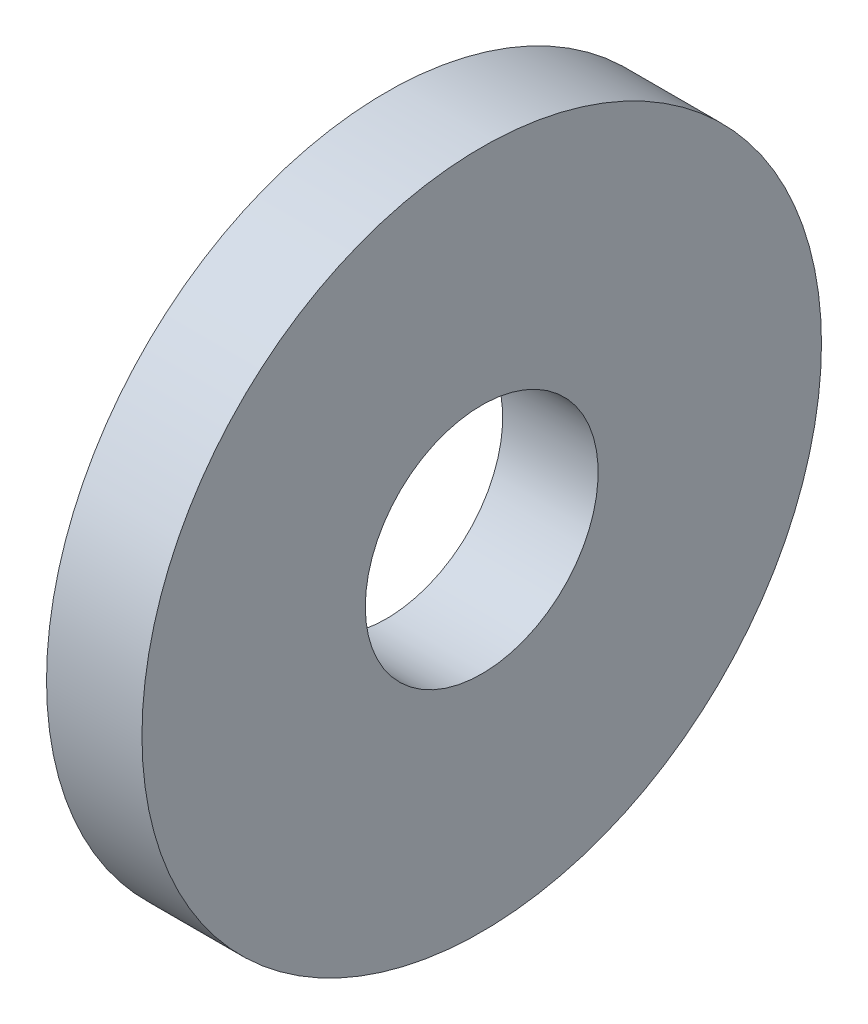
from build123d import *

# Parameters (mm, degrees)
SKETCH1_W = 2.5
SKETCH1_H = 5.85


with BuildPart() as part:
    # Sketch1 → Revolve1 (revolve)
    with BuildSketch(Plane.XY):
        with Locations((-1.25, 5.975)):
            Rectangle(SKETCH1_W, SKETCH1_H)
    revolve(axis=Axis((-10, 0, 0), (1, 0, 0)))


solid = part.part
